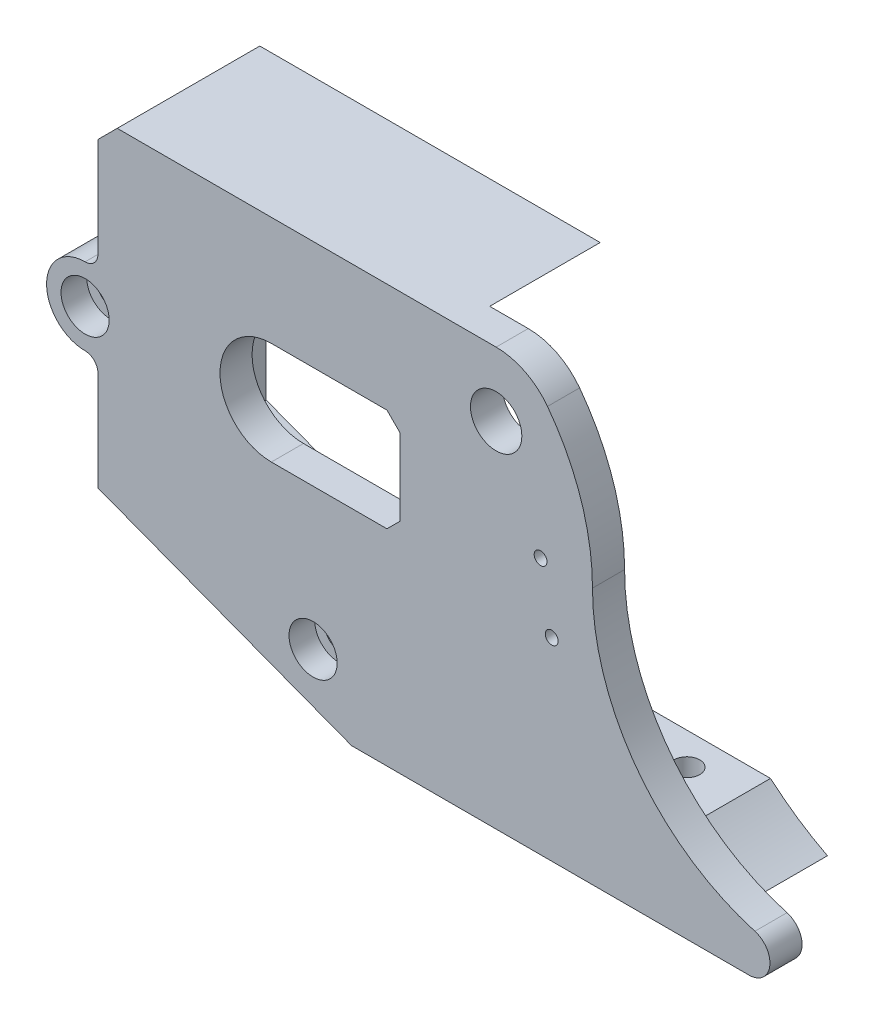
from build123d import *

# Parameters (mm, degrees)
BOSS_EXTRUDE1_DEPTH = 17.2
CHAMFER3_SIZE       = 3
CHAMFER2_SIZE       = 2
SKETCH2_R           = 4
SKETCH2_R_2         = 2.1
BOSS_EXTRUDE2_DEPTH = 5
SKETCH3_R           = 1
CUT_EXTRUDE1_DEPTH  = 5
BOSS_EXTRUDE8_START = 17.2
SKETCH10_R          = 2.1
BOSS_EXTRUDE8_DEPTH = 17.2
SKETCH11_R          = 3.75
CUT_EXTRUDE2_DEPTH  = 4
BOSS_EXTRUDE9_DEPTH = 22.2
FILLET3_R           = 2
SKETCH13_R          = 2
CUT_EXTRUDE3_DEPTH  = 22.2
SKETCH14_R          = 3.75
CUT_EXTRUDE4_DEPTH  = 4
SKETCH15_R          = 2
CUT_EXTRUDE5_DEPTH  = 6
FILLET4_R           = 2
CHAMFER4_SIZE       = 2


with BuildPart() as part:
    # Sketch1 → Boss-Extrude1 (new body)
    with BuildSketch(Plane.XY):
        with BuildLine():
            Line((-112, 25), (-112, -25))
            Line((-112, -25), (-72.5, -40))
            Line((-72.5, -40), (-20.615528128, -40))
            ThreePointArc((-20.615528128, -40), (-25.226188309, -37.264452544), (-29.478805946, -34))
            Line((-29.478805946, -34), (-77.032741633, -34))
            Line((-77.032741633, -34), (-108, -22.240281633))
            Line((-108, -22.240281633), (-108, 21))
            Line((-108, 21), (-60, 21))
            ThreePointArc((-60, 21), (-58.246211251, 23.246211251), (-56, 25))
            Line((-56, 25), (-112, 25))
        make_face()
    extrude(amount=BOSS_EXTRUDE1_DEPTH)

    # Chamfer3
    chamfer3_edges = [part.edges().sort_by_distance(p)[0] for p in [
        (-112, 25, 8.6),
    ]]
    chamfer(chamfer3_edges, length=CHAMFER3_SIZE)

    # Chamfer2
    chamfer2_edges = [part.edges().sort_by_distance(p)[0] for p in [
        (-108, 21, 8.6),
    ]]
    chamfer(chamfer2_edges, length=CHAMFER2_SIZE)

    # Sketch2 → Boss-Extrude2 (add)
    with BuildSketch(Plane.XY.offset(17.2)):
        with BuildLine():
            Line((-72.5, -40), (-20.615528128, -40))
            Line((-20.615528128, -40), (-10.615528128, -40))
            ThreePointArc((-10.615528128, -40), (-7.396351284, -37.204380582), (-9.713234444, -33.625185154))
            ThreePointArc((-9.713234444, -33.625185154), (-27.972872623, -21.03612125), (-35, 0))
            ThreePointArc((-35, 0), (-36.796084568, 11.067971811), (-42, 21))
            ThreePointArc((-42, 21), (-45.527864045, 23.94427191), (-50, 25))
            Line((-50, 25), (-109, 25))
            Line((-109, 25), (-112, 22))
            Line((-112, 22), (-112, -25))
            Line((-112, -25), (-72.5, -40))
        make_face()
        with Locations((-50, 15)):
            Circle(SKETCH2_R, mode=Mode.SUBTRACT)
        with Locations((-78.5, -30)):
            Circle(SKETCH2_R_2, mode=Mode.SUBTRACT)
        with BuildLine():
            Line((-85, 8), (-65, 8))
            Line((-65, 8), (-65, -8))
            Line((-65, -8), (-85, -8))
            ThreePointArc((-85, -8), (-93, 0), (-85, 8))
        make_face(mode=Mode.SUBTRACT)
    extrude(amount=BOSS_EXTRUDE2_DEPTH)

    # Sketch3 → Cut-Extrude1 (cut)
    with BuildSketch(Plane.XY.offset(22.2)):
        with Locations((-43.079744456, 0)):
            Circle(SKETCH3_R)
        with Locations((-41.343262679, -9.84807753)):
            Circle(SKETCH3_R)
    extrude(amount=-CUT_EXTRUDE1_DEPTH, mode=Mode.SUBTRACT)

    # Sketch10 → Boss-Extrude8 (add)
    with BuildSketch(Plane(origin=(0, 0, 17.2), x_dir=(-1, 0, 0), z_dir=(0, 0, -1)).offset(BOSS_EXTRUDE8_START)):
        with BuildLine():
            Line((83.5, -30), (83.5, -34))
            Line((83.5, -34), (73.5, -34))
            Line((73.5, -34), (73.5, -30))
            ThreePointArc((73.5, -30), (78.5, -25), (83.5, -30))
        make_face()
        with Locations((78.5, -30)):
            Circle(SKETCH10_R, mode=Mode.SUBTRACT)
    extrude(amount=-BOSS_EXTRUDE8_DEPTH)

    # Sketch11 → Cut-Extrude2 (cut)
    with BuildSketch(Plane.XY.offset(22.2)):
        with Locations((-78.5, -30)):
            Circle(SKETCH11_R)
    extrude(amount=-CUT_EXTRUDE2_DEPTH, mode=Mode.SUBTRACT)

    # Sketch12 → Boss-Extrude9 (add)
    with BuildSketch(Plane.XY.offset(22.2)):
        with BuildLine():
            Line((-114, 4.5), (-112, 4.5))
            Line((-112, 4.5), (-112, -7.5))
            Line((-112, -7.5), (-114, -7.5))
            ThreePointArc((-114, -7.5), (-120, -1.5), (-114, 4.5))
        make_face()
    extrude(amount=-BOSS_EXTRUDE9_DEPTH)

    # Fillet3
    fillet3_edges = [part.edges().sort_by_distance(p)[0] for p in [
        (-112, -7.5, 11.1),
        (-112, 4.5, 11.1),
    ]]
    fillet(fillet3_edges, radius=FILLET3_R - 0.0001)  # a hair under: the kernel refuses the full size

    # Sketch13 → Cut-Extrude3 (cut)
    with BuildSketch(Plane.XY.offset(22.2)):
        with Locations((-114, -1.5)):
            Circle(SKETCH13_R)
    extrude(amount=-CUT_EXTRUDE3_DEPTH, mode=Mode.SUBTRACT)

    # Sketch14 → Cut-Extrude4 (cut)
    with BuildSketch(Plane.XY.offset(22.2)):
        with Locations((-114, -1.5)):
            Circle(SKETCH14_R)
    extrude(amount=-CUT_EXTRUDE4_DEPTH, mode=Mode.SUBTRACT)

    # Sketch15 → Cut-Extrude5 (cut)
    with BuildSketch(Plane.XZ.offset(40)):
        with Locations((-37.5, 5)):
            Circle(SKETCH15_R)
    extrude(amount=-CUT_EXTRUDE5_DEPTH, mode=Mode.SUBTRACT)

    # Fillet4
    fillet4_edges = [part.edges().sort_by_distance(p)[0] for p in [
        (-73.5, -34, 8.6),
        (-83.5, -31.544079101, 8.6),
    ]]
    fillet(fillet4_edges, radius=FILLET4_R)

    # Chamfer4
    chamfer4_edges = [part.edges().sort_by_distance(p)[0] for p in [
        (-65, -8, 19.7),
        (-65, 8, 19.7),
    ]]
    chamfer(chamfer4_edges, length=CHAMFER4_SIZE)


solid = part.part
